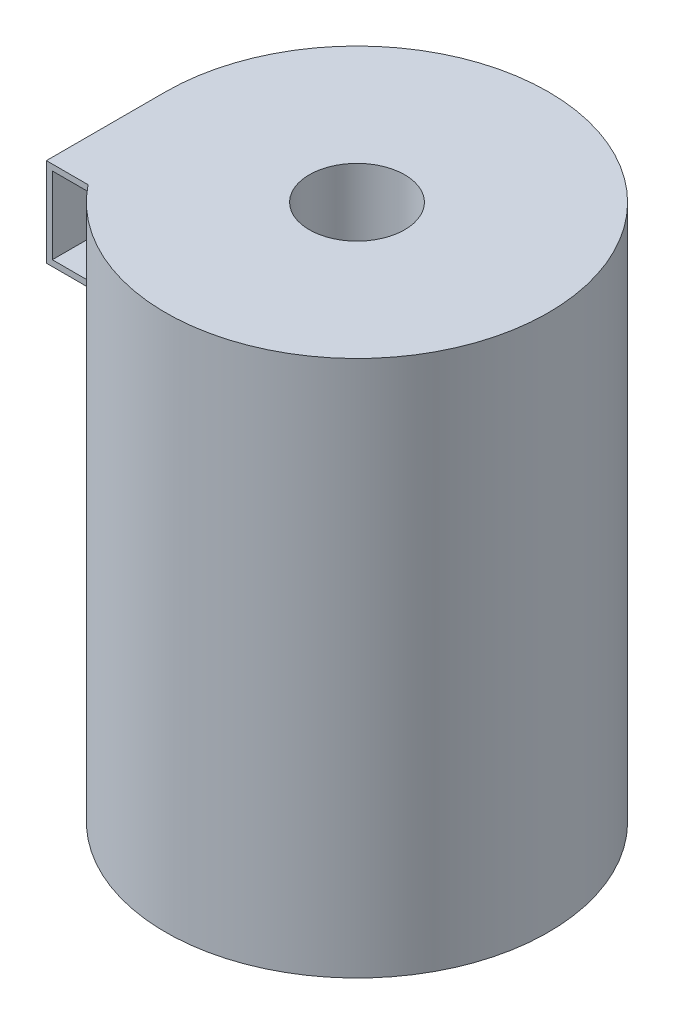
from build123d import *

# Parameters (mm, degrees)
SKETCH_4_W          = 9
SKETCH_4_H          = 14.9
EXTRUDE_3_DEPTH     = 20
SHELL_2_OUTLINE_R   = 31.1
SHELL_2_OUTLINE_R_2 = 9
SHELL_2_DEPTH       = 89
SHELL_2_2_OUTLINE_R = 9
SHELL_2_2_DEPTH     = 19
SHELL_START         = 76.1
SHELL_2_3_DEPTH     = 12.9


# Read off the part's stored shape, not the designer's step: 쉘2
with BuildPart() as part:
    # 스케치3 → 회전1 (revolve)
    with BuildSketch(Plane.XY, mode=Mode.PRIVATE) as revolve_1_sk:
        Polygon((0, 19), (8, 19), (8, 90), (32.1, 90), (32.1, 0), (0, 0), align=None)
    revolve(revolve_1_sk.sketch.rotate(Axis((0, 0, 0), (0, 1, 0)), 90), axis=Axis((0, 0, 0), (0, 1, 0)))

    # 스케치4 → 보스-돌출3 (add)
    with BuildSketch(Plane.XY):
        with Locations((-27.6, 82.55)):
            Rectangle(SKETCH_4_W, SKETCH_4_H)
    extrude(amount=EXTRUDE_3_DEPTH)

    # 쉘2 outline → 쉘2 (cut)
    with BuildSketch(Plane(origin=(0, 0, 0), x_dir=(1, 0, 0), z_dir=(0, 1, 0))):
        Circle(SHELL_2_OUTLINE_R)
        Circle(SHELL_2_OUTLINE_R_2, mode=Mode.SUBTRACT)
    extrude(amount=SHELL_2_DEPTH, mode=Mode.SUBTRACT)

    # Shell 2 2 outline → Shell 2 2 (cut)
    with BuildSketch(Plane(origin=(0, 0, 0), x_dir=(1, 0, 0), z_dir=(0, 1, 0))):
        Circle(SHELL_2_2_OUTLINE_R)
    extrude(amount=SHELL_2_2_DEPTH, mode=Mode.SUBTRACT)

    # Shell 2 3 outline → Shell 2 3 (cut)
    with BuildSketch(Plane(origin=(0, 0, 0), x_dir=(1, 0, 0), z_dir=(0, 1, 0)).offset(SHELL_START)):
        with BuildLine():
            ThreePointArc((-23.816170977, -20), (-29.222362305, -10.642534534), (-31.1, 0))
            Line((-31.1, 0), (-31.1, -20))
            Line((-31.1, -20), (-23.816170977, -20))
        make_face()
    extrude(amount=SHELL_2_3_DEPTH, mode=Mode.SUBTRACT)


solid = part.part
